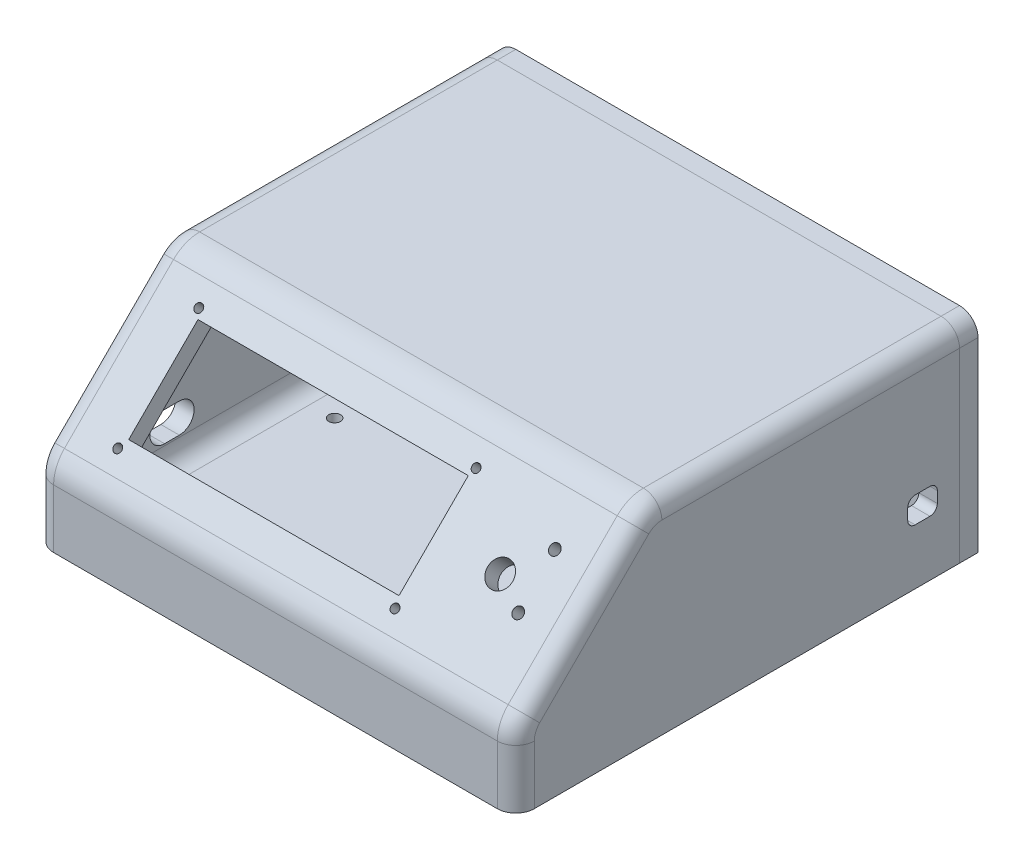
from build123d import *

# Parameters (mm, degrees)
BOSS_EXTRUDE1_DEPTH                                 = 130
SHELL1_T                                            = -5
SKETCH3_R                                           = 3.4
SKETCH3_W                                           = 73.1
SKETCH3_H                                           = 26.5
CUT_EXTRUDE1_DEPTH                                  = 5
FILLET1_R                                           = 10
FILLET2_R                                           = 5
CUT_EXTRUDE2_DEPTH                                  = 5
FILLET3_R                                           = 5
CUT_EXTRUDE3_REACH                                  = 191.36
SKETCH5_R                                           = 1.4
CUT_EXTRUDE4_REACH                                  = 191.36
SKETCH6_R                                           = 1.1
CUT_EXTRUDE5_REACH                                  = 185.945
SKETCH7_R                                           = 1.5
CSK_FOR_M3_COUNTERSUNK_FLAT_HEAD_SCREW2_D           = 3.2
CSK_FOR_M3_COUNTERSUNK_FLAT_HEAD_SCREW2_DEPTH       = 8
CSK_FOR_M3_COUNTERSUNK_FLAT_HEAD_SCREW2_CSINK_D     = 6.3
CSK_FOR_M3_COUNTERSUNK_FLAT_HEAD_SCREW2_CSINK_ANGLE = 90
CSK_FOR_M3_COUNTERSUNK_FLAT_HEAD_SCREW2_TIP         = 0.96137699
CUT_EXTRUDE6_REACH                                  = 187.376
SKETCH15_R                                          = 1.2
CUT_EXTRUDE7_DEPTH                                  = 20
SKETCH16_R                                          = 1.2
BOSS_EXTRUDE2_DEPTH                                 = 5
CSK_FOR_M3_COUNTERSUNK_FLAT_HEAD_SCR_2_COUNT        = 2
CSK_FOR_M3_COUNTERSUNK_FLAT_HEAD_SCR_2_PITCH        = 47.355339059
CSK_FOR_M3_COUNTERSUNK_FLAT_HEAD_SCR_3_COUNT        = 2
CSK_FOR_M3_COUNTERSUNK_FLAT_HEAD_SCR_3_PITCH        = 122
CSK_FOR_M3_COUNTERSUNK_FLAT_HEAD_SCR_4_COUNT        = 2
CSK_FOR_M3_COUNTERSUNK_FLAT_HEAD_SCR_4_PITCH        = 130.868361866


with BuildPart() as part:
    # Sketch2 → Boss-Extrude1 (new body)
    with BuildSketch(Plane(origin=(0, 0, 0), x_dir=(0, 0, -1), z_dir=(1, 0, 0))):
        Polygon((0, 0), (0, 20), (35.355339059, 55.355339059), (120, 55.355339059), (120, 0), align=None)
    extrude(amount=BOSS_EXTRUDE1_DEPTH)

    # Shell1
    shell1_openings = [part.faces().sort_by_distance(p)[0] for p in [
        (65, 27.67766953, -120),
    ]]
    offset(amount=SHELL1_T, openings=shell1_openings, kind=Kind.INTERSECTION)

    # Sketch3 → Cut-Extrude1 (cut)
    with BuildSketch(Plane(origin=(0, 10, 10), x_dir=(1, 0, 0), z_dir=(0, 0.7071067811865486, 0.7071067811865465))):
        with Locations(Location((108.1, 39.142135624, 0), (0, 0, 270))):
            Circle(SKETCH3_R)
        with Locations((53.55, 39.142135624)):
            Rectangle(SKETCH3_W, SKETCH3_H)
    extrude(amount=-CUT_EXTRUDE1_DEPTH, mode=Mode.SUBTRACT)

    # Fillet1
    # the kernel refuses this fillet: 10 mm, written as the material it adds along each edge
    with BuildSketch(Plane(origin=(125, 50.355339059, -37.426406871), x_dir=(0, 0, -1), z_dir=(-1, 0, 0)), Plane(origin=(125, 17.928932188, -5), x_dir=(0, 0.7071067811865465, -0.7071067811865486), z_dir=(-1, 0, 0))) as fillet1_piece_1:
        with BuildLine():
            CenterArc((FILLET1_R * 0.414213562373, FILLET1_R), FILLET1_R, 225, 45)
            Line((-FILLET1_R * 0.292893218813, FILLET1_R * 0.292893218813), (0, 0))
            Line((0, 0), (FILLET1_R * 0.414213562373, 0))
        make_face()
    extrude(amount=120)
    with BuildSketch(Plane(origin=(5, 5, -5), x_dir=(0, 0, -1), z_dir=(1, 0, 0))) as fillet1_piece_2:
        with BuildLine():
            CenterArc((FILLET1_R, FILLET1_R), FILLET1_R, 180, 90)
            Line((0, FILLET1_R), (0, 0))
            Line((0, 0), (FILLET1_R, 0))
        make_face()
    extrude(amount=120)
    # the kernel refuses this fillet: 10 mm, written as the material it takes off along each edge
    with BuildSketch(Plane(origin=(-10.355339059, 20, 0), x_dir=(0, -1, 0), z_dir=(1, 0, 0)), Plane(origin=(-10.355339059, 55.355339059, -35.355339059), x_dir=(0, -0.7071067811865476, 0.7071067811865476), z_dir=(1, 0, 0))) as fillet1_2_piece_1:
        with BuildLine():
            CenterArc((FILLET1_R * 0.414213562373, FILLET1_R), FILLET1_R, 225, 45)
            Line((-FILLET1_R * 0.292893218813, FILLET1_R * 0.292893218813), (0, 0))
            Line((0, 0), (FILLET1_R * 0.414213562373, 0))
        make_face()
    extrude(amount=150.710678119, mode=Mode.SUBTRACT)

    # Fillet2
    fillet2_edges = [part.edges().sort_by_distance(p)[0] for p in [
        (130, 55.355339059, -79.748737342),
        (0, 7.928932188, 0),
        (130, 7.928932188, 0),
        (0, 37.67766953, -17.67766953),
        (0, 54.594134384, -35.670640359),
        (0, 19.6846987, -0.761204675),
        (130, 37.67766953, -17.67766953),
        (130, 54.594134384, -35.670640359),
        (130, 19.6846987, -0.761204675),
        (0, 55.355339059, -79.748737342),
    ]]
    fillet(fillet2_edges, radius=FILLET2_R)

    # Sketch4 → Cut-Extrude2 (cut)
    with BuildSketch(Plane(origin=(130, 0, 0), x_dir=(0, 0, -1), z_dir=(1, 0, 0))):
        with BuildLine():
            Line((108, 22), (112, 22))
            ThreePointArc((112, 22), (113.414213562, 21.414213562), (114, 20))
            Line((114, 20), (114, 17))
            ThreePointArc((114, 17), (113.414213562, 15.585786438), (112, 15))
            Line((112, 15), (108, 15))
            ThreePointArc((108, 15), (106.585786438, 15.585786438), (106, 17))
            Line((106, 17), (106, 20))
            ThreePointArc((106, 20), (106.585786438, 21.414213562), (108, 22))
        make_face()
    extrude(amount=-CUT_EXTRUDE2_DEPTH, mode=Mode.SUBTRACT)

    # Fillet3
    # the kernel refuses this fillet: 5 mm, written as the material it adds along each edge
    with BuildSketch(Plane(origin=(5, 50.355339059, -120), x_dir=(1, 0, 0), z_dir=(0, 0, 1))) as fillet3_piece_1:
        with BuildLine():
            CenterArc((FILLET3_R, -FILLET3_R), FILLET3_R, 90, 90)
            Line((0, -FILLET3_R), (0, 0))
            Line((0, 0), (FILLET3_R, 0))
        make_face()
    fillet3_piece_1_solid = extrude(amount=78.431457505, mode=Mode.PRIVATE)
    with BuildSketch(Plane(origin=(125, 50.355339059, -120), x_dir=(-1, 0, 0), z_dir=(0, 0, 1))) as fillet3_piece_2:
        with BuildLine():
            CenterArc((FILLET3_R, FILLET3_R), FILLET3_R, 180, 90)
            Line((0, FILLET3_R), (0, 0))
            Line((0, 0), (FILLET3_R, 0))
        make_face()
    fillet3_piece_2_solid = extrude(amount=78.431457505, mode=Mode.PRIVATE)
    with BuildSketch(Plane(origin=(5, 5, -15), x_dir=(0, 1, 0), z_dir=(0, 0, -1)), Plane(origin=(125, 5, -15), x_dir=(-1, 0, 0), z_dir=(0, 0, -1))) as fillet3_piece_3:
        with BuildLine():
            CenterArc((FILLET3_R, FILLET3_R), FILLET3_R, 180, 90)
            Line((0, FILLET3_R), (0, 0))
            Line((0, 0), (FILLET3_R, 0))
        make_face()
    fillet3_piece_3_solid = extrude(amount=105, mode=Mode.PRIVATE)
    with BuildSketch(Plane(origin=(5, 47.426406871, -34.497474683), x_dir=(0, -0.7071067811865487, -0.7071067811865464), z_dir=(0, -0.7071067811865465, 0.7071067811865487))) as fillet3_piece_4:
        with BuildLine():
            CenterArc((FILLET3_R, FILLET3_R), FILLET3_R, 180, 90)
            Line((0, FILLET3_R), (0, 0))
            Line((0, 0), (FILLET3_R, 0))
        make_face()
    fillet3_piece_4_solid = extrude(amount=37.573593129, mode=Mode.PRIVATE)
    with BuildSketch(Plane(origin=(5, 13.786796564, -15), x_dir=(0, -0.9281493111658919, 0.3722080818336436), z_dir=(0, -0.3722080818336436, -0.9281493111658919))) as fillet3_piece_5:
        with BuildLine():
            CenterArc((10 - FILLET3_R, -FILLET3_R), FILLET3_R, 0, 90)
            Line((10, -FILLET3_R), (10, 0))
            Line((10, 0), (10 - FILLET3_R, 0))
        make_face()
    fillet3_piece_5_solid = revolve(axis=Axis((5, 13.786796564, -15), (-1, 0, 0)), revolution_arc=113.148139986, mode=Mode.PRIVATE)
    with BuildSketch(Plane(origin=(5, 15, -15), x_dir=(0, 0.9282822091618541, 0.37187651196813665), z_dir=(0, 0.37187651196813665, -0.9282822091618541))) as fillet3_piece_6:
        with BuildLine():
            CenterArc((10 - FILLET3_R, FILLET3_R), FILLET3_R, 270, 90)
            Line((10, FILLET3_R), (10, 0))
            Line((10, 0), (10 - FILLET3_R, 0))
        make_face()
    fillet3_piece_6_solid = revolve(axis=Axis((5, 15, -15), (1, 0, 0)), revolution_arc=158.168606729, mode=Mode.PRIVATE)
    with BuildSketch(Plane(origin=(5, 40.355339059, -41.568542495), x_dir=(0, 0.7071067811865476, 0.7071067811865476), z_dir=(0, -0.7071067811865476, 0.7071067811865476))) as fillet3_piece_7:
        with BuildLine():
            CenterArc((10 - FILLET3_R, -FILLET3_R), FILLET3_R, 0, 90)
            Line((10, -FILLET3_R), (10, 0))
            Line((10, 0), (10 - FILLET3_R, 0))
        make_face()
    fillet3_piece_7_solid = revolve(axis=Axis((5, 40.355339059, -41.568542495), (-1, 0, 0)), revolution_arc=45, mode=Mode.PRIVATE)
    with BuildSketch(Plane(origin=(125, 47.426406871, -34.497474683), x_dir=(-2.842170943040401e-15, -0.7071067811865487, -0.7071067811865464), z_dir=(0, -0.7071067811865465, 0.7071067811865487))) as fillet3_piece_8:
        with BuildLine():
            CenterArc((FILLET3_R, -FILLET3_R), FILLET3_R, 90, 90)
            Line((0, -FILLET3_R), (0, 0))
            Line((0, 0), (FILLET3_R, 0))
        make_face()
    fillet3_piece_8_solid = extrude(amount=37.573593129, mode=Mode.PRIVATE)
    with BuildSketch(Plane(origin=(125, 13.786796564, -15), x_dir=(0, -0.9281493111658919, 0.3722080818336436), z_dir=(0, -0.3722080818336436, -0.9281493111658919))) as fillet3_piece_9:
        with BuildLine():
            CenterArc((10 - FILLET3_R, FILLET3_R), FILLET3_R, 270, 90)
            Line((10, FILLET3_R), (10, 0))
            Line((10, 0), (10 - FILLET3_R, 0))
        make_face()
    fillet3_piece_9_solid = revolve(axis=Axis((125, 13.786796564, -15), (-1, 0, 0)), revolution_arc=113.148139986, mode=Mode.PRIVATE)
    with BuildSketch(Plane(origin=(125, 15, -15), x_dir=(0, 0.9282822091618541, 0.37187651196813665), z_dir=(0, 0.37187651196813665, -0.9282822091618541))) as fillet3_piece_10:
        with BuildLine():
            CenterArc((10 - FILLET3_R, -FILLET3_R), FILLET3_R, 0, 90)
            Line((10, -FILLET3_R), (10, 0))
            Line((10, 0), (10 - FILLET3_R, 0))
        make_face()
    fillet3_piece_10_solid = revolve(axis=Axis((125, 15, -15), (1, 0, 0)), revolution_arc=158.168606729, mode=Mode.PRIVATE)
    with BuildSketch(Plane(origin=(125, 40.355339059, -41.568542495), x_dir=(0, 0.7071067811865476, 0.7071067811865476), z_dir=(0, -0.7071067811865476, 0.7071067811865476))) as fillet3_piece_11:
        with BuildLine():
            CenterArc((10 - FILLET3_R, FILLET3_R), FILLET3_R, 270, 90)
            Line((10, FILLET3_R), (10, 0))
            Line((10, 0), (10 - FILLET3_R, 0))
        make_face()
    fillet3_piece_11_solid = revolve(axis=Axis((125, 40.355339059, -41.568542495), (-1, 0, 0)), revolution_arc=45, mode=Mode.PRIVATE)
    add([fillet3_piece_1_solid, fillet3_piece_2_solid, fillet3_piece_3_solid, fillet3_piece_4_solid, fillet3_piece_5_solid, fillet3_piece_6_solid, fillet3_piece_7_solid, fillet3_piece_8_solid, fillet3_piece_9_solid, fillet3_piece_10_solid, fillet3_piece_11_solid])

    # Sketch5 → Cut-Extrude3 (cut, up to next)
    with BuildSketch(Plane(origin=(0, 10, 10), x_dir=(1, 0, 0), z_dir=(0, 0.7071067811865486, 0.7071067811865465)), mode=Mode.PRIVATE) as cut_extrude3_sk1:
        with Locations(Location((116.3, 48.442135624, 0), (0, 0, 270))):
            Circle(SKETCH5_R)
    cut_extrude3_tool1 = extrude(cut_extrude3_sk1.sketch, amount=-CUT_EXTRUDE3_REACH, mode=Mode.PRIVATE) & part.part
    # Sketch5 → Cut-Extrude3 (cut, up to next)
    with BuildSketch(Plane(origin=(0, 10, 10), x_dir=(1, 0, 0), z_dir=(0, 0.7071067811865486, 0.7071067811865465)), mode=Mode.PRIVATE) as cut_extrude3_sk2:
        with Locations(Location((116.3, 34.442135624, 0), (0, 0, 270))):
            Circle(SKETCH5_R)
    cut_extrude3_tool2 = extrude(cut_extrude3_sk2.sketch, amount=-CUT_EXTRUDE3_REACH, mode=Mode.PRIVATE) & part.part
    add(cut_extrude3_tool1.solids().sort_by_distance((116.3, 44.253763, -24.253763))[0], mode=Mode.SUBTRACT)
    add(cut_extrude3_tool2.solids().sort_by_distance((116.3, 34.354268, -14.354268))[0], mode=Mode.SUBTRACT)

    # Sketch6 → Cut-Extrude4 (cut, up to next)
    with BuildSketch(Plane(origin=(0, 10, 10), x_dir=(1, 0, 0), z_dir=(0, 0.7071067811865486, 0.7071067811865465)), mode=Mode.PRIVATE) as cut_extrude4_sk1:
        with Locations(Location((15.8, 54.392135624, 0), (0, 0, 270))):
            Circle(SKETCH6_R)
    cut_extrude4_tool1 = extrude(cut_extrude4_sk1.sketch, amount=-CUT_EXTRUDE4_REACH, mode=Mode.PRIVATE) & part.part
    # Sketch6 → Cut-Extrude4 (cut, up to next)
    with BuildSketch(Plane(origin=(0, 10, 10), x_dir=(1, 0, 0), z_dir=(0, 0.7071067811865486, 0.7071067811865465)), mode=Mode.PRIVATE) as cut_extrude4_sk2:
        with Locations(Location((90.8, 54.392135624, 0), (0, 0, 270))):
            Circle(SKETCH6_R)
    cut_extrude4_tool2 = extrude(cut_extrude4_sk2.sketch, amount=-CUT_EXTRUDE4_REACH, mode=Mode.PRIVATE) & part.part
    # Sketch6 → Cut-Extrude4 (cut, up to next)
    with BuildSketch(Plane(origin=(0, 10, 10), x_dir=(1, 0, 0), z_dir=(0, 0.7071067811865486, 0.7071067811865465)), mode=Mode.PRIVATE) as cut_extrude4_sk3:
        with Locations(Location((90.8, 23.392135624, 0), (0, 0, 270))):
            Circle(SKETCH6_R)
    cut_extrude4_tool3 = extrude(cut_extrude4_sk3.sketch, amount=-CUT_EXTRUDE4_REACH, mode=Mode.PRIVATE) & part.part
    # Sketch6 → Cut-Extrude4 (cut, up to next)
    with BuildSketch(Plane(origin=(0, 10, 10), x_dir=(1, 0, 0), z_dir=(0, 0.7071067811865486, 0.7071067811865465)), mode=Mode.PRIVATE) as cut_extrude4_sk4:
        with Locations(Location((15.8, 23.392135624, 0), (0, 0, 270))):
            Circle(SKETCH6_R)
    cut_extrude4_tool4 = extrude(cut_extrude4_sk4.sketch, amount=-CUT_EXTRUDE4_REACH, mode=Mode.PRIVATE) & part.part
    add(cut_extrude4_tool1.solids().sort_by_distance((15.8, 48.461048, -28.461048))[0], mode=Mode.SUBTRACT)
    add(cut_extrude4_tool2.solids().sort_by_distance((90.8, 48.461048, -28.461048))[0], mode=Mode.SUBTRACT)
    add(cut_extrude4_tool3.solids().sort_by_distance((90.8, 26.540738, -6.540738))[0], mode=Mode.SUBTRACT)
    add(cut_extrude4_tool4.solids().sort_by_distance((15.8, 26.540738, -6.540738))[0], mode=Mode.SUBTRACT)

    # Sketch7 → Cut-Extrude5 (cut, up to next)
    with BuildSketch(Plane(origin=(0, 5, 0), x_dir=(1, 0, 0), z_dir=(0, 1, 0)), mode=Mode.PRIVATE) as cut_extrude5_sk1:
        with Locations(Location((16.5, 21.5, 0), (0, 0, 270))):
            Circle(SKETCH7_R)
    cut_extrude5_tool1 = extrude(cut_extrude5_sk1.sketch, amount=-CUT_EXTRUDE5_REACH, mode=Mode.PRIVATE) & part.part
    # Sketch7 → Cut-Extrude5 (cut, up to next)
    with BuildSketch(Plane(origin=(0, 5, 0), x_dir=(1, 0, 0), z_dir=(0, 1, 0)), mode=Mode.PRIVATE) as cut_extrude5_sk2:
        with Locations(Location((16.5, 64.5, 0), (0, 0, 270))):
            Circle(SKETCH7_R)
    cut_extrude5_tool2 = extrude(cut_extrude5_sk2.sketch, amount=-CUT_EXTRUDE5_REACH, mode=Mode.PRIVATE) & part.part
    # Sketch7 → Cut-Extrude5 (cut, up to next)
    with BuildSketch(Plane(origin=(0, 5, 0), x_dir=(1, 0, 0), z_dir=(0, 1, 0)), mode=Mode.PRIVATE) as cut_extrude5_sk3:
        with Locations(Location((109.5, 21.5, 0), (0, 0, 270))):
            Circle(SKETCH7_R)
    cut_extrude5_tool3 = extrude(cut_extrude5_sk3.sketch, amount=-CUT_EXTRUDE5_REACH, mode=Mode.PRIVATE) & part.part
    # Sketch7 → Cut-Extrude5 (cut, up to next)
    with BuildSketch(Plane(origin=(0, 5, 0), x_dir=(1, 0, 0), z_dir=(0, 1, 0)), mode=Mode.PRIVATE) as cut_extrude5_sk4:
        with Locations(Location((109.5, 64.5, 0), (0, 0, 270))):
            Circle(SKETCH7_R)
    cut_extrude5_tool4 = extrude(cut_extrude5_sk4.sketch, amount=-CUT_EXTRUDE5_REACH, mode=Mode.PRIVATE) & part.part
    # Sketch7 → Cut-Extrude5 (cut, up to next)
    with BuildSketch(Plane(origin=(0, 5, 0), x_dir=(1, 0, 0), z_dir=(0, 1, 0)), mode=Mode.PRIVATE) as cut_extrude5_sk5:
        with Locations(Location((109, 79, 0), (0, 0, 270))):
            Circle(SKETCH7_R)
    cut_extrude5_tool5 = extrude(cut_extrude5_sk5.sketch, amount=-CUT_EXTRUDE5_REACH, mode=Mode.PRIVATE) & part.part
    # Sketch7 → Cut-Extrude5 (cut, up to next)
    with BuildSketch(Plane(origin=(0, 5, 0), x_dir=(1, 0, 0), z_dir=(0, 1, 0)), mode=Mode.PRIVATE) as cut_extrude5_sk6:
        with Locations(Location((53, 79, 0), (0, 0, 270))):
            Circle(SKETCH7_R)
    cut_extrude5_tool6 = extrude(cut_extrude5_sk6.sketch, amount=-CUT_EXTRUDE5_REACH, mode=Mode.PRIVATE) & part.part
    # Sketch7 → Cut-Extrude5 (cut, up to next)
    with BuildSketch(Plane(origin=(0, 5, 0), x_dir=(1, 0, 0), z_dir=(0, 1, 0)), mode=Mode.PRIVATE) as cut_extrude5_sk7:
        with Locations(Location((53, 115, 0), (0, 0, 270))):
            Circle(SKETCH7_R)
    cut_extrude5_tool7 = extrude(cut_extrude5_sk7.sketch, amount=-CUT_EXTRUDE5_REACH, mode=Mode.PRIVATE) & part.part
    # Sketch7 → Cut-Extrude5 (cut, up to next)
    with BuildSketch(Plane(origin=(0, 5, 0), x_dir=(1, 0, 0), z_dir=(0, 1, 0)), mode=Mode.PRIVATE) as cut_extrude5_sk8:
        with Locations(Location((109, 115, 0), (0, 0, 270))):
            Circle(SKETCH7_R)
    cut_extrude5_tool8 = extrude(cut_extrude5_sk8.sketch, amount=-CUT_EXTRUDE5_REACH, mode=Mode.PRIVATE) & part.part
    add(cut_extrude5_tool1.solids().sort_by_distance((16.5, 5, -21.5))[0], mode=Mode.SUBTRACT)
    add(cut_extrude5_tool2.solids().sort_by_distance((16.5, 5, -64.5))[0], mode=Mode.SUBTRACT)
    add(cut_extrude5_tool3.solids().sort_by_distance((109.5, 5, -21.5))[0], mode=Mode.SUBTRACT)
    add(cut_extrude5_tool4.solids().sort_by_distance((109.5, 5, -64.5))[0], mode=Mode.SUBTRACT)
    add(cut_extrude5_tool5.solids().sort_by_distance((109, 5, -79))[0], mode=Mode.SUBTRACT)
    add(cut_extrude5_tool6.solids().sort_by_distance((53, 5, -79))[0], mode=Mode.SUBTRACT)
    add(cut_extrude5_tool7.solids().sort_by_distance((53, 5, -115))[0], mode=Mode.SUBTRACT)
    add(cut_extrude5_tool8.solids().sort_by_distance((109, 5, -115))[0], mode=Mode.SUBTRACT)

    # CSK for M3 Countersunk Flat Head Screw2
    with Locations(Plane(origin=(0, 0, 0), x_dir=(-1, 0, 0), z_dir=(0, -1, 0))):
        with Locations((-109, 115), (-53, 115), (-53, 79), (-109, 79), (-16.5, 64.5), (-16.5, 21.5), (-109.5, 21.5), (-109.5, 64.5)):
            CounterSinkHole(CSK_FOR_M3_COUNTERSUNK_FLAT_HEAD_SCREW2_D / 2, CSK_FOR_M3_COUNTERSUNK_FLAT_HEAD_SCREW2_CSINK_D / 2, depth=CSK_FOR_M3_COUNTERSUNK_FLAT_HEAD_SCREW2_DEPTH, counter_sink_angle=CSK_FOR_M3_COUNTERSUNK_FLAT_HEAD_SCREW2_CSINK_ANGLE)
            with Locations((0, 0, -(CSK_FOR_M3_COUNTERSUNK_FLAT_HEAD_SCREW2_DEPTH + CSK_FOR_M3_COUNTERSUNK_FLAT_HEAD_SCREW2_TIP / 2))):  # 118° drill point
                Cone(0, CSK_FOR_M3_COUNTERSUNK_FLAT_HEAD_SCREW2_D / 2, CSK_FOR_M3_COUNTERSUNK_FLAT_HEAD_SCREW2_TIP, mode=Mode.SUBTRACT)

    # Sketch14 → Cut-Extrude6 (cut, up to next)
    with BuildSketch(Plane.ZY, mode=Mode.PRIVATE) as cut_extrude6_sk1:
        with BuildLine():
            Line((-34, 18.5), (-30, 18.5))
            ThreePointArc((-30, 18.5), (-26, 14.5), (-30, 10.5))
            Line((-30, 10.5), (-34, 10.5))
            ThreePointArc((-34, 10.5), (-38, 14.5), (-34, 18.5))
        make_face()
    cut_extrude6_tool1 = extrude(cut_extrude6_sk1.sketch, amount=-CUT_EXTRUDE6_REACH, mode=Mode.PRIVATE) & part.part
    add(cut_extrude6_tool1.solids().sort_by_distance((0, 14.5, -32))[0], mode=Mode.SUBTRACT)

    # Sketch15 → Cut-Extrude7 (cut)
    with BuildSketch(Plane(origin=(0, 0, -120), x_dir=(-1, 0, 0), z_dir=(0, 0, -1))):
        with Locations((-126, 51.355339059)):
            Circle(SKETCH15_R)
        with Locations((-126, 4)):
            Circle(SKETCH15_R)
        with Locations((-4, 4)):
            Circle(SKETCH15_R)
        with Locations((-4, 51.355339059)):
            Circle(SKETCH15_R)
    extrude(amount=-CUT_EXTRUDE7_DEPTH, mode=Mode.SUBTRACT)


with BuildPart() as body_2:
    # Sketch16 → Boss-Extrude2 (new body)
    with BuildSketch(Plane(origin=(0, 0, -120), x_dir=(-1, 0, 0), z_dir=(0, 0, -1))):
        with BuildLine():
            Line((0, 0), (0, 50.355339059))
            ThreePointArc((0, 50.355339059), (-1.464466094, 53.890872965), (-5, 55.355339059))
            Line((-5, 55.355339059), (-125, 55.355339059))
            ThreePointArc((-125, 55.355339059), (-128.535533906, 53.890872965), (-130, 50.355339059))
            Line((-130, 50.355339059), (-130, 0))
            Line((-130, 0), (0, 0))
        make_face()
        with Locations((-126, 4)):
            Circle(SKETCH16_R, mode=Mode.SUBTRACT)
        with Locations((-4, 4)):
            Circle(SKETCH16_R, mode=Mode.SUBTRACT)
        with Locations((-4, 51.355339059)):
            Circle(SKETCH16_R, mode=Mode.SUBTRACT)
        with Locations((-126, 51.355339059)):
            Circle(SKETCH16_R, mode=Mode.SUBTRACT)
    extrude(amount=BOSS_EXTRUDE2_DEPTH)

    # Sketch20 → CSK for M3 Countersunk Flat Head Screw3 (revolve, cut)
    with BuildSketch(Plane(origin=(126, 51.355339059, -125), x_dir=(0, 1, 0), z_dir=(1, 0, 0))):
        Polygon((0, 0), (0, 8.96137699), (1.6, 8), (1.6, 1.55), (3.15, 0), align=None)
    csk_for_m3_countersunk_flat_head_screw3 = revolve(axis=Axis((126, 51.355339059, -131.35), (0, 0, 1)), mode=Mode.SUBTRACT)

    # CSK for M3 Countersunk Flat Head Scr 2: CSK for M3 Countersunk Flat Head Screw3 ×2
    with Locations(*[(0, -i * CSK_FOR_M3_COUNTERSUNK_FLAT_HEAD_SCR_2_PITCH, 0) for i in range(1, CSK_FOR_M3_COUNTERSUNK_FLAT_HEAD_SCR_2_COUNT)]):
        add(csk_for_m3_countersunk_flat_head_screw3, mode=Mode.SUBTRACT)

    # CSK for M3 Countersunk Flat Head Scr 3: CSK for M3 Countersunk Flat Head Screw3 ×2
    with Locations(*[(-i * CSK_FOR_M3_COUNTERSUNK_FLAT_HEAD_SCR_3_PITCH, 0, 0) for i in range(1, CSK_FOR_M3_COUNTERSUNK_FLAT_HEAD_SCR_3_COUNT)]):
        add(csk_for_m3_countersunk_flat_head_screw3, mode=Mode.SUBTRACT)

    # CSK for M3 Countersunk Flat Head Scr 4: CSK for M3 Countersunk Flat Head Screw3 ×2
    with Locations(*[Vector(-0.9322344855600483, -0.3618547552991284, 0) * (i * CSK_FOR_M3_COUNTERSUNK_FLAT_HEAD_SCR_4_PITCH) for i in range(1, CSK_FOR_M3_COUNTERSUNK_FLAT_HEAD_SCR_4_COUNT)]):
        add(csk_for_m3_countersunk_flat_head_screw3, mode=Mode.SUBTRACT)


solid = Compound([part.part, body_2.part])
